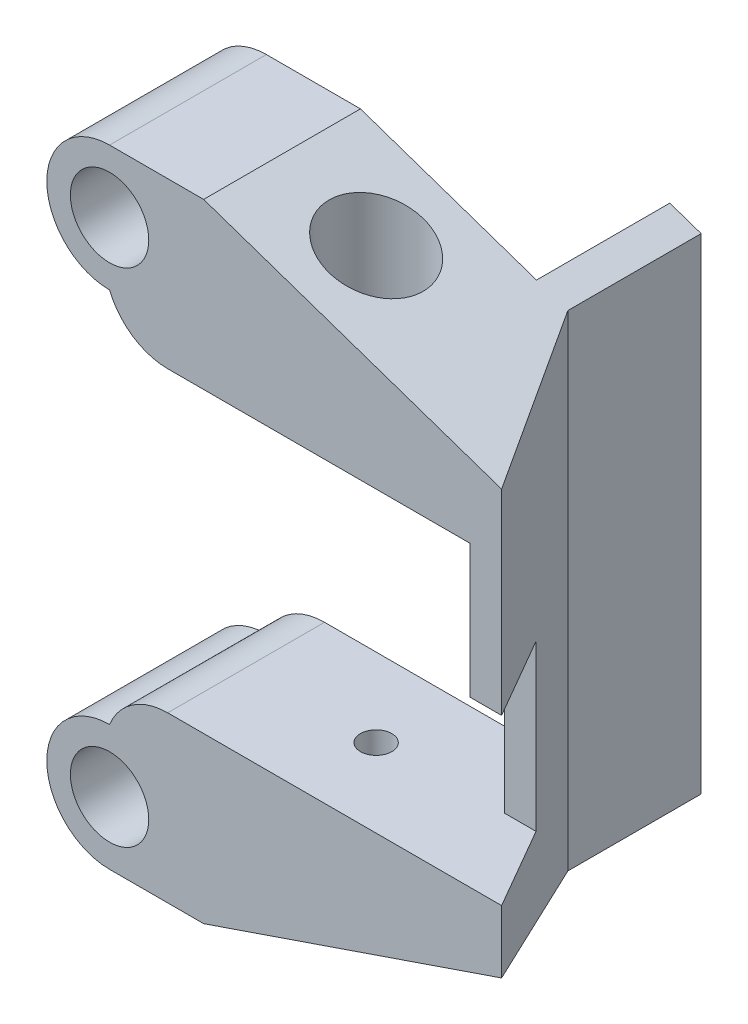
from build123d import *

# Parameters (mm, degrees)
CROQUIS1_R                = 2.5
SALIENTE_EXTRUIR1_DEPTH   = 10
CROQUIS2_R                = 1
CORTAR_EXTRUIR1_DEPTH     = 4
SALIENTE_EXTRUIR2_DEPTH   = 13.5
CROQUIS4_R                = 3
CORTAR_EXTRUIR2_DEPTH     = 1
SALIENTE_EXTRUIR3_START   = 6.5
CROQUIS6_R                = 3
SALIENTE_EXTRUIR3_DEPTH   = 6.5
CORTAR_EXTRUIR4_DEPTH     = 10
SALIENTE_EXTRUIR4_DEPTH   = 8.5
CORTAR_EXTRUIR5_START     = -5.196152423
CORTAR_EXTRUIR5_OUTLINE_W = 8
CORTAR_EXTRUIR5_OUTLINE_H = 10.5
CORTAR_EXTRUIR5_DEPTH     = 5.196152423
REDONDEO1_R               = 4


# Read off the part's stored shape, not the designer's step: Cortar-Extruir5
with BuildPart() as part:
    # Croquis1 → Saliente-Extruir1 (new body)
    with BuildSketch(Plane.XY):
        with BuildLine():
            Line((-106.231635218, 22.700651543), (-131.231635218, 22.700651543))
            Line((-131.231635218, 22.700651543), (-131.231635218, 20.200651543))
            ThreePointArc((-131.231635218, 20.200651543), (-135.231635218, 16.200651543), (-131.231635218, 12.200651543))
            Line((-131.231635218, 12.200651543), (-125.231635218, 12.200651543))
            Line((-125.231635218, 12.200651543), (-125.231635218, 18.700651543))
            Line((-125.231635218, 18.700651543), (-106.231635218, 18.700651543))
            Line((-106.231635218, 18.700651543), (-106.231635218, 22.700651543))
        make_face()
        with Locations((-131.231635218, 16.200651543)):
            Circle(CROQUIS1_R, mode=Mode.SUBTRACT)
    extrude(amount=SALIENTE_EXTRUIR1_DEPTH)

    # Croquis2 → Cortar-Extruir1 (cut)
    with BuildSketch(Plane.XZ.offset(-18.700651543)):
        with Locations(Location((-119.231635218, 5, 0), (0, 0, 270))):
            Circle(CROQUIS2_R)
        Polygon((-106.231635218, 0), (-106.231635218, 10), (-112.00513791, 0), align=None)
    extrude(amount=-CORTAR_EXTRUIR1_DEPTH, mode=Mode.SUBTRACT)

    # Croquis3 → Saliente-Extruir2 (add)
    with BuildSketch(Plane.XZ.offset(-18.700651543)):
        Polygon((-106.231635218, 10), (-108.231635218, 10), (-114.00513791, 0), (-112.00513791, 0), align=None)
    extrude(amount=-SALIENTE_EXTRUIR2_DEPTH)

    # Croquis4 → Cortar-Extruir2 (cut)
    with BuildSketch(Plane.XZ.offset(-18.700651543)):
        with Locations(Location((-119.231635218, 5, 0), (0, 0, 270))):
            Circle(CROQUIS4_R)
    extrude(amount=-CORTAR_EXTRUIR2_DEPTH, mode=Mode.SUBTRACT)

    # Croquis6 → Saliente-Extruir3 (add)
    with BuildSketch(Plane.XZ.offset(-18.700651543).offset(SALIENTE_EXTRUIR3_START)):
        Polygon((-125.231635218, 10), (-106.231635218, 10), (-112.00513791, 0), (-125.231635218, 0), align=None)
        with Locations(Location((-119.231635218, 5, 0), (0, 0, 270))):
            Circle(CROQUIS6_R, mode=Mode.SUBTRACT)
    extrude(amount=-SALIENTE_EXTRUIR3_DEPTH)

    # Croquis7 → Cortar-Extruir4 (cut)
    with BuildSketch(Plane.XY.offset(10)):
        Polygon((-106.231635218, 18.700651543), (-106.231635218, 12.200651543), (-125.231635218, 12.200651543), align=None)
    extrude(amount=-CORTAR_EXTRUIR4_DEPTH, mode=Mode.SUBTRACT)

    # Croquis8 → Saliente-Extruir4 (add)
    with BuildSketch(Plane(origin=(0, 0, 0), x_dir=(-1, 0, 0), z_dir=(0, 0, -1))):
        Polygon((112.00513791, 16.725505885), (112.00513791, 32.200651543), (114.00513791, 32.200651543), (114.00513791, 22.700651543), (114.00513791, 16.041295359), align=None)
    extrude(amount=SALIENTE_EXTRUIR4_DEPTH)

    # Simetría1: part across plane


with BuildPart() as part_1:
    add(part.part)
    add(part.part.mirror(Plane(origin=(0, 32.200651543, 0), x_dir=(0, 0, 1), z_dir=(0, -1, 0))))

    # Cortar-Extruir5 outline → Cortar-Extruir5 (cut)
    with BuildSketch(Plane.XY.offset(10).offset(CORTAR_EXTRUIR5_START)):
        with Locations((-109, 27.950651543)):
            Rectangle(CORTAR_EXTRUIR5_OUTLINE_W, CORTAR_EXTRUIR5_OUTLINE_H)
    extrude(amount=CORTAR_EXTRUIR5_DEPTH, mode=Mode.SUBTRACT)

    # Redondeo1
    # the kernel refuses this fillet: 4 mm, written as the material it takes off along each edge
    with BuildSketch(Plane(origin=(-131.231635218, 41.700651543, -9.270248109), x_dir=(1, 0, 0), z_dir=(0, 0, 1))) as redondeo1_piece_1:
        with BuildLine():
            CenterArc((3.708099244, 4), REDONDEO1_R, 202.024312837, 67.975687163)
            Line((0, 2.5), (-0.074161985, 2.47))
            ThreePointArc((-0.074161985, 2.47), (-0.08, 1.25), (-0.08, 0))
            Line((-0.08, 0), (0, -0.08))
            Line((0, -0.08), (3.708099244, -0.08))
            Line((3.708099244, -0.08), (3.708099244, 0))
        make_face()
    extrude(amount=28.540496218, mode=Mode.SUBTRACT)
    with BuildSketch(Plane(origin=(-131.231635218, 22.700651543, -9.270248109), x_dir=(0, -1, 0), z_dir=(0, 0, 1))) as redondeo1_piece_2:
        with BuildLine():
            CenterArc((4, 3.708099244), REDONDEO1_R, 180, 67.975687168)
            Line((0, 3.708099244), (-0.08, 3.708099244))
            Line((-0.08, 3.708099244), (-0.08, 0))
            Line((-0.08, 0), (0, -0.08))
            ThreePointArc((0, -0.08), (1.25, -0.08), (2.47, -0.074161985))
            Line((2.47, -0.074161985), (2.5, 0))
        make_face()
    extrude(amount=28.540496218, mode=Mode.SUBTRACT)


solid = part_1.part
